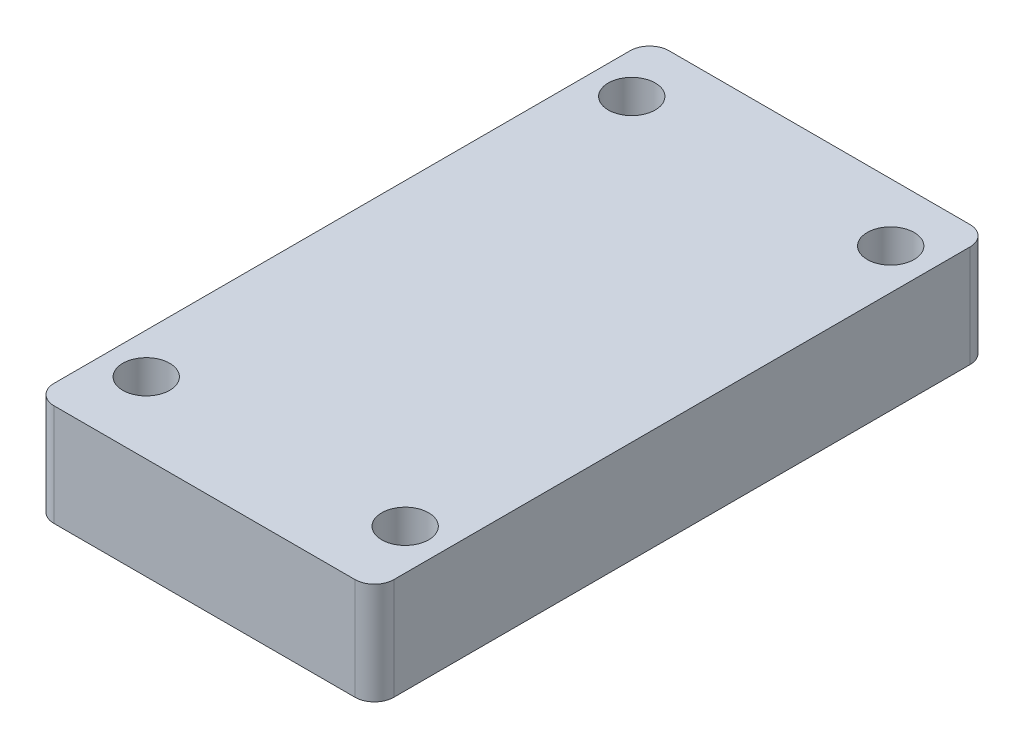
from build123d import *

# Parameters (mm, degrees)
SKETCH_1_W          = 21
SKETCH_1_H          = 38
EXTRUDE_1_DEPTH     = 6.3
FILLET_1_R          = 1.2
SKETCH_2_R          = 1.45
CUT_EXTRUDE_1_DEPTH = 23.60398195


with BuildPart() as part:
    # 草图1 → 凸台-拉伸1 (new body)
    with BuildSketch(Plane(origin=(0, 0, 0), x_dir=(1, 0, 0), z_dir=(0, 1, 0))):
        Rectangle(SKETCH_1_W, SKETCH_1_H)
    extrude(amount=EXTRUDE_1_DEPTH)

    # 圆角1
    fillet_1_edges = [part.edges().sort_by_distance(p)[0] for p in [
        (-10.5, 3.15, -19),
        (10.5, 3.15, -19),
        (-10.5, 3.15, 19),
        (10.5, 3.15, 19),
    ]]
    fillet(fillet_1_edges, radius=FILLET_1_R)

    # 草图2 → 切除-拉伸1 (cut, through all)
    with BuildSketch(Plane(origin=(0, 6.3, 0), x_dir=(1, 0, 0), z_dir=(0, 1, 0))):
        with Locations((-8, 15.4)):
            Circle(SKETCH_2_R)
        with Locations((8, 15.4)):
            Circle(SKETCH_2_R)
        with Locations((-8, -14.6)):
            Circle(SKETCH_2_R)
        with Locations((8, -14.6)):
            Circle(SKETCH_2_R)
    extrude(amount=-CUT_EXTRUDE_1_DEPTH, mode=Mode.SUBTRACT)


solid = part.part
